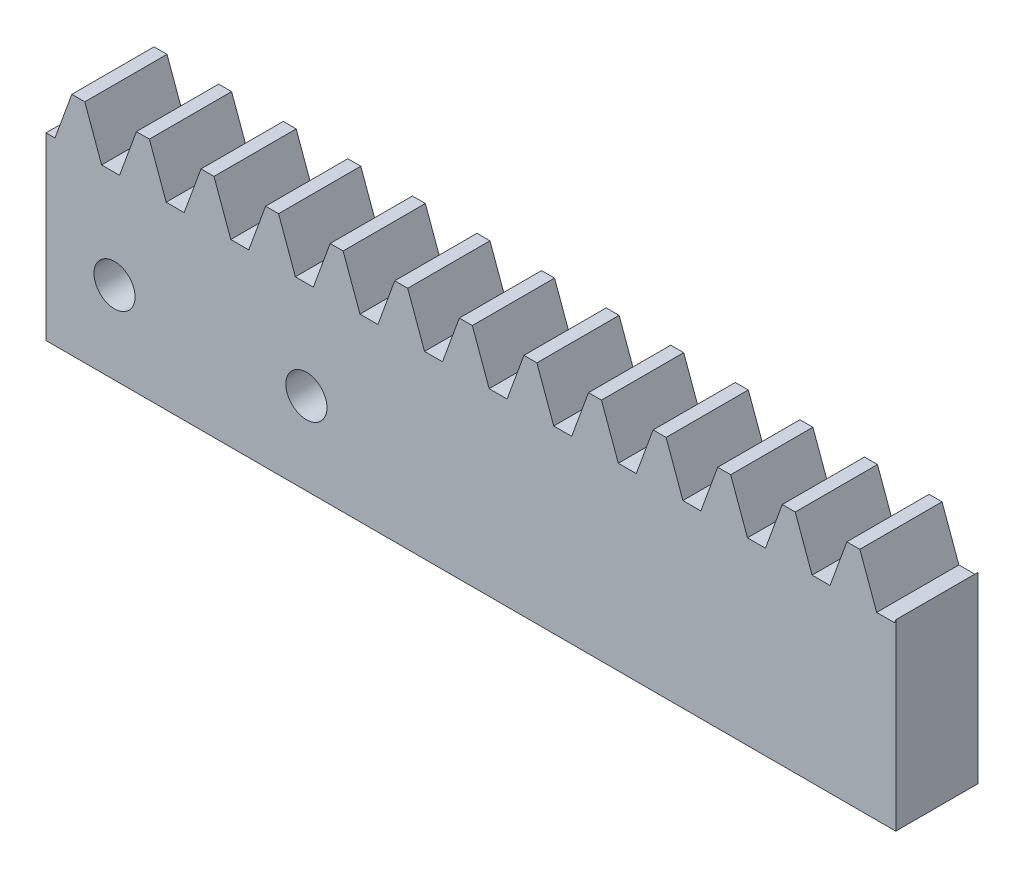
from build123d import *

# Parameters (mm, degrees)
BLANKSKE_W              = 62
BLANKSKE_H              = 16.5
BLANK_DEPTH             = 6
TOOTHCUTSIM_DEPTH       = 65.437954654
TEETHCUTS_COUNT         = 15
TEETHCUTS_PITCH         = 4.712388975
ESQUISSE2_R             = 1.5
ENL_V_MAT_EXTRU_1_DEPTH = 6


with BuildPart() as part:
    # BlankSke → Blank (new body)
    with BuildSketch(Plane.XY):
        with Locations((31, 8.25)):
            Rectangle(BLANKSKE_W, BLANKSKE_H)
    extrude(amount=-BLANK_DEPTH)

    # TooCutSkeSim → ToothCutSim (cut, through all)
    with BuildSketch(Plane.XY):
        Polygon((0.654653055, 13.125), (-0.654653055, 13.125), (-1.892297439, 16.5254), (1.892297439, 16.5254), align=None)
    toothcutsim = extrude(amount=-TOOTHCUTSIM_DEPTH, mode=Mode.SUBTRACT)

    # TeethCuts: ToothCutSim ×15
    with Locations(*[(i * TEETHCUTS_PITCH, 0, 0) for i in range(1, TEETHCUTS_COUNT)]):
        add(toothcutsim, mode=Mode.SUBTRACT)

    # Esquisse2 → Enlèv. mat.-Extru.1 (cut)
    with BuildSketch(Plane.XY):
        with Locations((5, 6)):
            Circle(ESQUISSE2_R)
        with Locations((19, 6)):
            Circle(ESQUISSE2_R)
    extrude(amount=-ENL_V_MAT_EXTRU_1_DEPTH, mode=Mode.SUBTRACT)


solid = part.part
